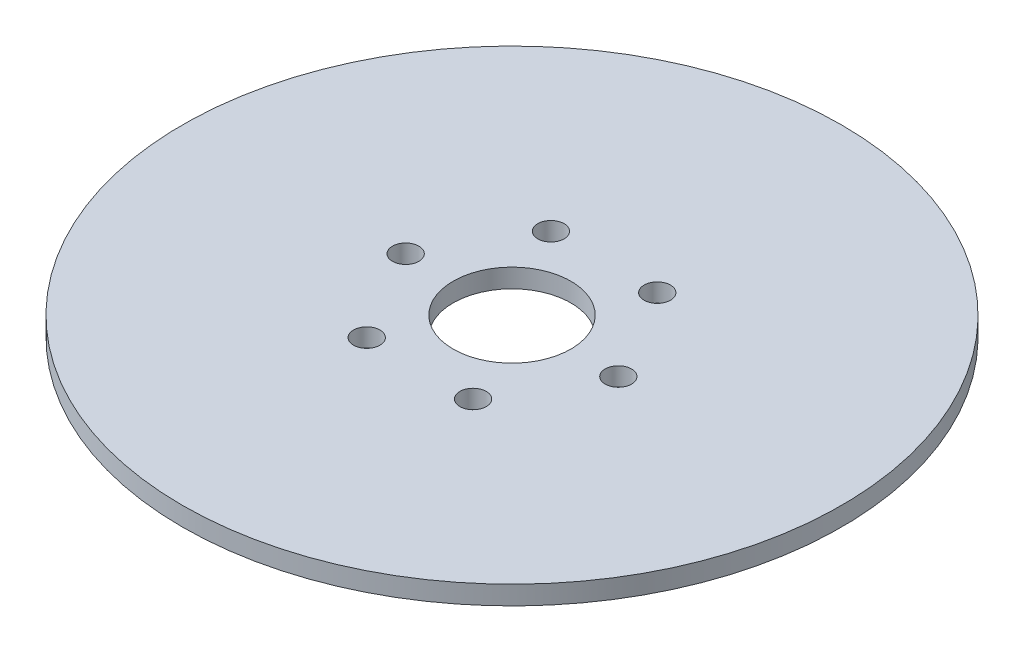
from build123d import *

# Parameters (mm, degrees)
SKETCH1_R           = 70
BOSS_EXTRUDE1_DEPTH = 4
SKETCH2_R           = 12.5
CUT_EXTRUDE1_DEPTH  = 100.075728612
SKETCH3_R           = 2.801634806
CUT_EXTRUDE2_DEPTH  = 3.917957982
CIRPATTERN1_COUNT   = 6


with BuildPart() as part:
    # Sketch1 → Boss-Extrude1 (new body)
    with BuildSketch(Plane(origin=(0, 0, 0), x_dir=(1, 0, 0), z_dir=(0, 1, 0))):
        Circle(SKETCH1_R)
    extrude(amount=BOSS_EXTRUDE1_DEPTH)

    # Sketch2 → Cut-Extrude1 (cut, through all)
    with BuildSketch(Plane(origin=(0, 0, 0), x_dir=(1, 0, 0), z_dir=(0, 1, 0))):
        Circle(SKETCH2_R)
    extrude(amount=CUT_EXTRUDE1_DEPTH, mode=Mode.SUBTRACT)

    # Sketch3 → Cut-Extrude2 (cut)
    with BuildSketch(Plane(origin=(0, 4, 0), x_dir=(1, 0, 0), z_dir=(0, 1, 0))):
        with Locations((-22.588161984, 0)):
            Circle(SKETCH3_R)
    cut_extrude2 = extrude(amount=-CUT_EXTRUDE2_DEPTH, mode=Mode.SUBTRACT)

    # CirPattern1: Cut-Extrude2 ×6 about axis
    cirpattern1_axis = Axis((0, 0, 0), (0, 1, 0))
    for i in range(1, CIRPATTERN1_COUNT):
        add(cut_extrude2.rotate(cirpattern1_axis, i * 360 / CIRPATTERN1_COUNT), mode=Mode.SUBTRACT)


solid = part.part
